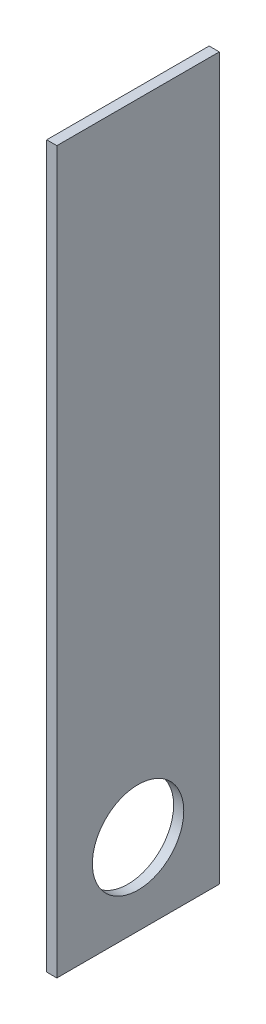
from build123d import *

# Parameters (mm, degrees)
SKETCH1_W           = 50.8
SKETCH1_H           = 225.425
SKETCH1_R           = 14.2875
BOSS_EXTRUDE1_DEPTH = 3.175


with BuildPart() as part:
    # Sketch1 → Boss-Extrude1 (new body)
    with BuildSketch(Plane(origin=(0, 0, 0), x_dir=(0, 0, -1), z_dir=(1, 0, 0))):
        Rectangle(SKETCH1_W, SKETCH1_H)
        with Locations((0, -87.3125)):
            Circle(SKETCH1_R, mode=Mode.SUBTRACT)
    extrude(amount=BOSS_EXTRUDE1_DEPTH)


solid = part.part
